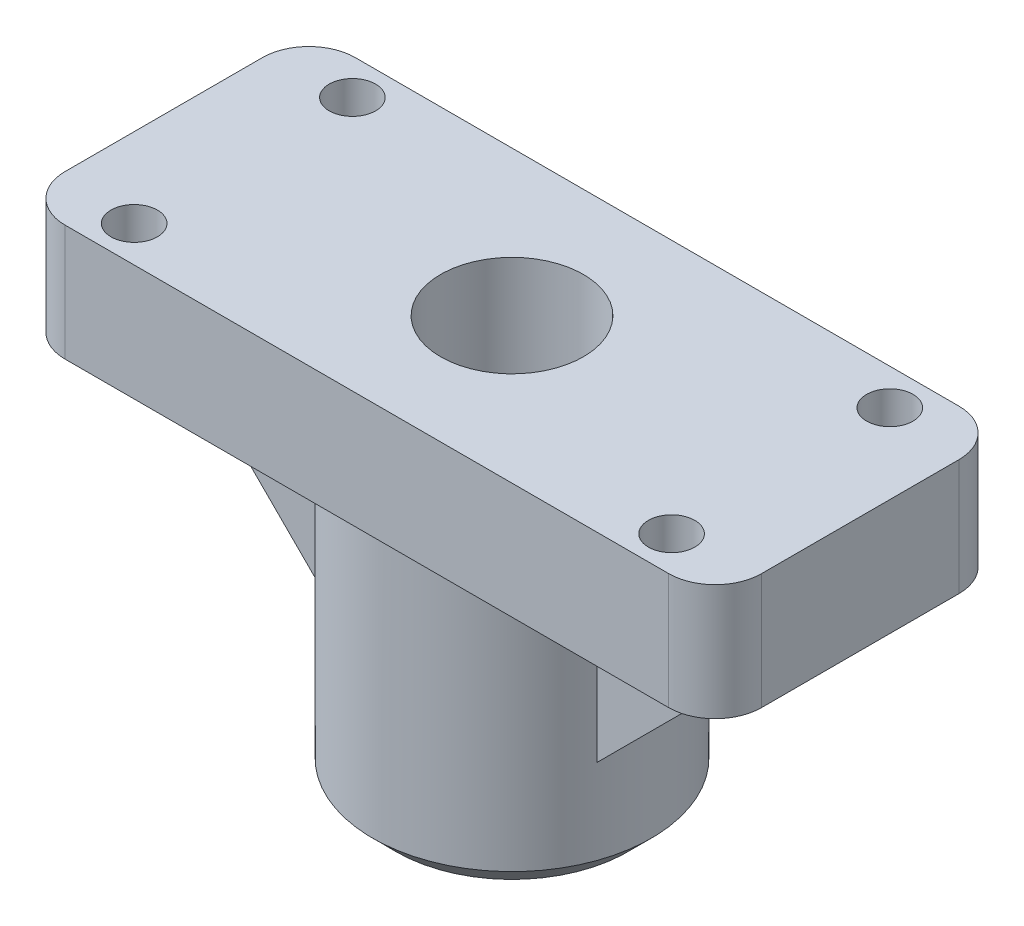
from build123d import *

# Parameters (mm, degrees)
SKETCH1_W            = 60
SKETCH1_H            = 25
BASE_DEPTH           = 10
PEN_HOLE_REACH       = 49.762
SKETCH5_R            = 6.15
STAB_FINS_DEPTH      = 4
STAB_FINS_DEPTH_BACK = 4
BASE_DEC_R           = 4
SKETCH8_R            = 2
CUT_EXTRUDE2_DEPTH   = 48.762432936
CHAMFER1_SIZE        = 2


with BuildPart() as part:
    # Sketch1 → Base (new body)
    with BuildSketch(Plane(origin=(0, 0, 0), x_dir=(1, 0, 0), z_dir=(0, 1, 0))):
        Rectangle(SKETCH1_W, SKETCH1_H)
    extrude(amount=BASE_DEPTH)

    # Sketch2 → Pen Catch (revolve)
    with BuildSketch(Plane.XY):
        Polygon((-6.15, 0), (-6.15, -7), (-5.35, -7), (-5.35, -25), (-12, -25), (-12, 0), align=None)
    revolve(axis=Axis((0, 0, 0), (0, -1, 0)))

    # Sketch5 → Pen Hole (cut, up to next)
    with BuildSketch(Plane(origin=(0, 10, 0), x_dir=(1, 0, 0), z_dir=(0, 1, 0)), mode=Mode.PRIVATE) as pen_hole_sk1:
        Circle(SKETCH5_R)
    pen_hole_tool1 = extrude(pen_hole_sk1.sketch, amount=-PEN_HOLE_REACH, mode=Mode.PRIVATE) & part.part
    add(pen_hole_tool1.solids().sort_by_distance((0, 10, 0))[0], mode=Mode.SUBTRACT)

    # Sketch4 → Stab Fins (add, two sides: drawn at the far end of the back side and taken through both)
    with BuildSketch(Plane.XY.offset(-STAB_FINS_DEPTH_BACK)):
        Polygon((-27, 0), (-9, 0), (-9, -18), align=None)
        Polygon((9, -18), (27, 0), (9, 0), align=None)
    extrude(amount=STAB_FINS_DEPTH + STAB_FINS_DEPTH_BACK)

    # Base Dec
    base_dec_edges = [part.edges().sort_by_distance(p)[0] for p in [
        (-30, 5, -12.5),
        (30, 5, 12.5),
        (30, 5, -12.5),
        (-30, 5, 12.5),
    ]]
    fillet(base_dec_edges, radius=BASE_DEC_R)

    # Sketch8 → Cut-Extrude2 (cut, through all)
    with BuildSketch(Plane(origin=(0, 10, 0), x_dir=(1, 0, 0), z_dir=(0, 1, 0))):
        with Locations((23.15, 9.4)):
            Circle(SKETCH8_R)
        with Locations((23.15, -9.4)):
            Circle(SKETCH8_R)
        with Locations((-23.15, 9.4)):
            Circle(SKETCH8_R)
        with Locations((-23.15, -9.4)):
            Circle(SKETCH8_R)
    extrude(amount=-CUT_EXTRUDE2_DEPTH, mode=Mode.SUBTRACT)

    # Chamfer1
    chamfer1_edges = [part.edges().sort_by_distance(p)[0] for p in [
        (12, -25, 0),
    ]]
    chamfer(chamfer1_edges, length=CHAMFER1_SIZE)


solid = part.part
